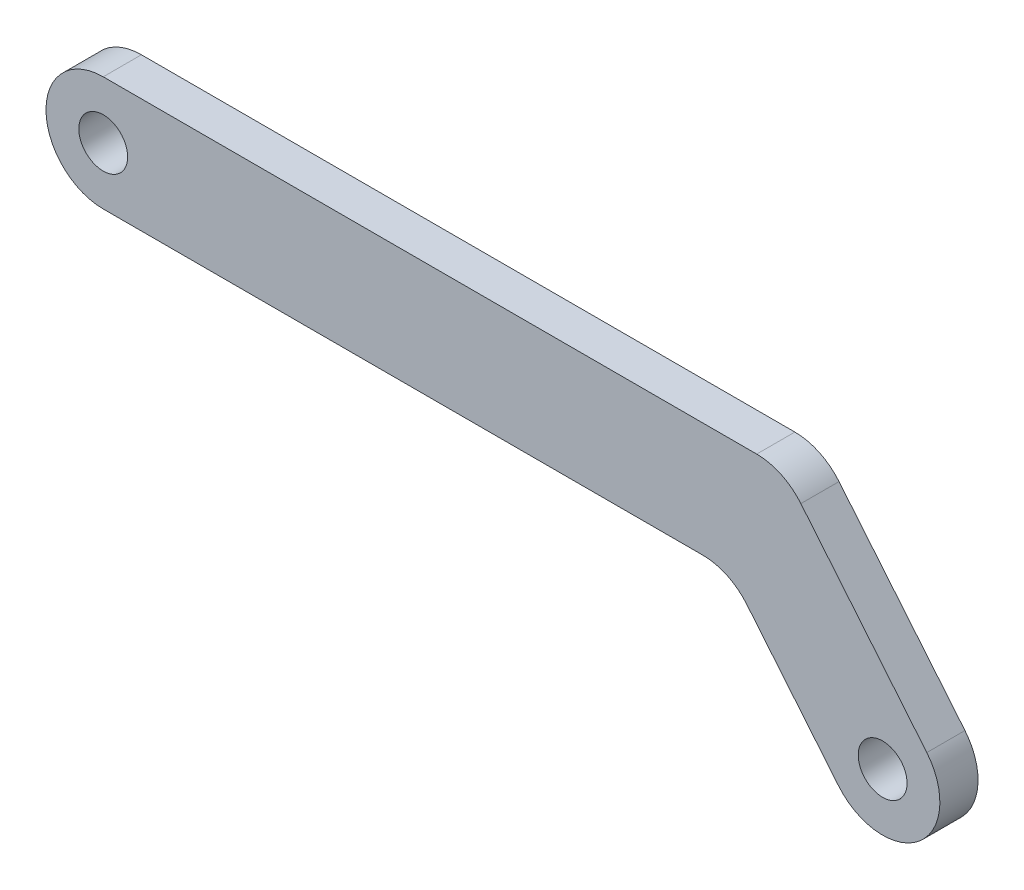
from build123d import *

# Parameters (mm, degrees)
SKETCH1_R           = 2.032
BOSS_EXTRUDE1_DEPTH = 3.175


with BuildPart() as part:
    # Sketch1 → Boss-Extrude1 (new body)
    with BuildSketch(Plane.XY):
        with BuildLine():
            Line((-64.847737492, 17.4625), (-10.4775, 17.4625))
            ThreePointArc((-10.4775, 17.4625), (-8.44681712, 17.007868764), (-6.803834761, 15.730773822))
            Line((-6.803834761, 15.730773822), (3.673665239, 3.030773822))
            ThreePointArc((3.673665239, 3.030773822), (3.030773822, -3.673665239), (-3.673665239, -3.030773822))
            Line((-3.673665239, -3.030773822), (-11.293817046, 6.205773822))
            ThreePointArc((-11.293817046, 6.205773822), (-12.936799404, 7.482868764), (-14.967482285, 7.9375))
            Line((-14.967482285, 7.9375), (-64.847737492, 7.9375))
            ThreePointArc((-64.847737492, 7.9375), (-69.610237492, 12.7), (-64.847737492, 17.4625))
        make_face()
        Circle(SKETCH1_R, mode=Mode.SUBTRACT)
        with Locations((-64.847737492, 12.7)):
            Circle(SKETCH1_R, mode=Mode.SUBTRACT)
    extrude(amount=BOSS_EXTRUDE1_DEPTH)


solid = part.part
